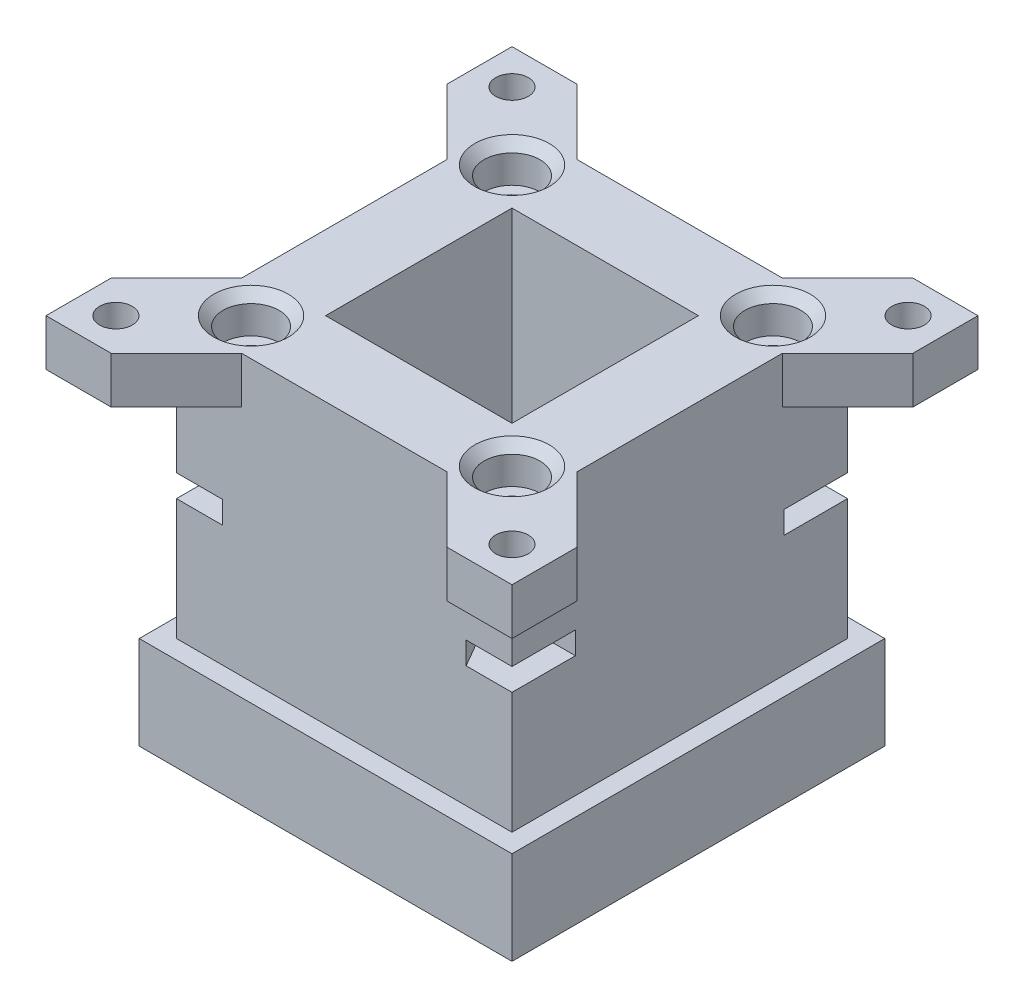
from build123d import *

# Parameters (mm, degrees)
SKETCH1_W           = 36
SKETCH1_H           = 36
SKETCH1_W_2         = 20
SKETCH1_H_2         = 20
BOSS_EXTRUDE4_DEPTH = 35
SKETCH9_W           = 50
SKETCH9_H           = 50
SKETCH9_W_2         = 22
SKETCH9_H_2         = 22
BOSS_EXTRUDE6_DEPTH = 5
SKETCH10_R          = 1.75
CUT_EXTRUDE2_DEPTH  = 10
CUT_EXTRUDE3_DEPTH  = 10
SKETCH4_W           = 40
SKETCH4_H           = 40
BOSS_EXTRUDE7_DEPTH = 10
SKETCH12_R          = 3
CUT_EXTRUDE4_DEPTH  = 4
CHAMFER1_SIZE       = 1
SKETCH13_R          = 1.75
CUT_EXTRUDE5_DEPTH  = 13
CUT_EXTRUDE7_DEPTH  = 2.4


with BuildPart() as part:
    # Sketch1 → Boss-Extrude4 (new body)
    with BuildSketch(Plane(origin=(0, 0, 0), x_dir=(1, 0, 0), z_dir=(0, 1, 0))):
        Rectangle(SKETCH1_W, SKETCH1_H)
        Rectangle(SKETCH1_W_2, SKETCH1_H_2, mode=Mode.SUBTRACT)
    extrude(amount=BOSS_EXTRUDE4_DEPTH)

    # Sketch9 → Boss-Extrude6 (add)
    with BuildSketch(Plane(origin=(0, 30, 0), x_dir=(1, 0, 0), z_dir=(0, 1, 0))):
        Rectangle(SKETCH9_W, SKETCH9_H)
        Rectangle(SKETCH9_W_2, SKETCH9_H_2, mode=Mode.SUBTRACT)
    extrude(amount=BOSS_EXTRUDE6_DEPTH)

    # Sketch10 → Cut-Extrude2 (cut)
    with BuildSketch(Plane(origin=(0, 25, 0), x_dir=(1, 0, 0), z_dir=(0, 1, 0))):
        with Locations((-21.25, 21.25)):
            Circle(SKETCH10_R)
        with Locations((21.25, 21.25)):
            Circle(SKETCH10_R)
        with Locations((21.25, -21.25)):
            Circle(SKETCH10_R)
        with Locations((-21.25, -21.25)):
            Circle(SKETCH10_R)
    extrude(amount=CUT_EXTRUDE2_DEPTH, mode=Mode.SUBTRACT)

    # Sketch11 → Cut-Extrude3 (cut)
    with BuildSketch(Plane(origin=(0, 25, 0), x_dir=(1, 0, 0), z_dir=(0, 1, 0))):
        Polygon((11, 18), (-11, 18), (-18, 25), (18, 25), align=None)
        Polygon((18, 11), (18, -11), (25, -18), (25, 18), align=None)
        Polygon((11, -18), (-11, -18), (-18, -25), (18, -25), align=None)
        Polygon((-18, 11), (-18, -11), (-25, -18), (-25, 18), align=None)
    extrude(amount=CUT_EXTRUDE3_DEPTH, mode=Mode.SUBTRACT)

    # Sketch4 → Boss-Extrude7 (add)
    with BuildSketch(Plane(origin=(0, -5, 0), x_dir=(1, 0, 0), z_dir=(0, 1, 0))):
        Rectangle(SKETCH4_W, SKETCH4_H)
        Polygon((-2.5, -8.548100716), (-2.5, -10), (-10, -10), (-10, -2.5), (-8.422351936, -2.5), (-4.844140472, -8.569430344), align=None, mode=Mode.SUBTRACT)
        Polygon((7.534421013, 0), (3.767210506, 6.525), (-3.767210506, 6.525), (-7.534421013, 0), (-3.767210506, -6.525), (3.767210506, -6.525), align=None, mode=Mode.SUBTRACT)
        Polygon((10, 10), (2.5, 10), (2.5, 8.548100716), (4.844140472, 8.569430344), (8.422351936, 2.5), (10, 2.5), align=None, mode=Mode.SUBTRACT)
        Polygon((10, -10), (2.5, -10), (2.5, -8.502605089), (4.999274138, -8.47986388), (8.379580585, -2.5), (10, -2.5), align=None, mode=Mode.SUBTRACT)
        Polygon((-10, 10), (-10, 2.5), (-8.379580585, 2.5), (-4.999274138, 8.47986388), (-2.5, 8.502605089), (-2.5, 10), align=None, mode=Mode.SUBTRACT)
    extrude(amount=BOSS_EXTRUDE7_DEPTH)

    # Sketch12 → Cut-Extrude4 (cut)
    with BuildSketch(Plane(origin=(0, 35, 0), x_dir=(1, 0, 0), z_dir=(0, 1, 0))):
        with Locations((-14, 14)):
            Circle(SKETCH12_R)
        with Locations((14, 14)):
            Circle(SKETCH12_R)
        with Locations((-14, -14)):
            Circle(SKETCH12_R)
        with Locations((14, -14)):
            Circle(SKETCH12_R)
    extrude(amount=-CUT_EXTRUDE4_DEPTH, mode=Mode.SUBTRACT)

    # Chamfer1
    chamfer1_edges = [part.edges().sort_by_distance(p)[0] for p in [
        (-17, 35, -14),
        (-17, 35, 14),
        (11, 35, 14),
        (11, 35, -14),
    ]]
    chamfer(chamfer1_edges, length=CHAMFER1_SIZE)

    # Sketch13 → Cut-Extrude5 (cut)
    with BuildSketch(Plane(origin=(0, 31, 0), x_dir=(1, 0, 0), z_dir=(0, 1, 0))):
        with Locations((-14, 14)):
            Circle(SKETCH13_R)
        with Locations((14, 14)):
            Circle(SKETCH13_R)
        with Locations((14, -14)):
            Circle(SKETCH13_R)
        with Locations((-14, -14)):
            Circle(SKETCH13_R)
    extrude(amount=-CUT_EXTRUDE5_DEPTH, mode=Mode.SUBTRACT)

    # Sketch15 → Cut-Extrude7 (cut)
    with BuildSketch(Plane(origin=(0, 18, 0), x_dir=(1, 0, 0), z_dir=(0, 1, 0))):
        Polygon((-10.766838493, 14), (-12.383419246, 16.8), (-15.581535205, 22.339299329), (-24.484943605, 19.967960566), (-22.149680093, 11.2), (-15.616580754, 11.2), (-12.383419246, 11.2), align=None)
        Polygon((15.616580754, 11.2), (12.383419246, 11.2), (10.766838493, 14), (12.383419246, 16.8), (15.581535205, 22.339299329), (24.484943605, 19.967960566), (22.149680093, 11.2), align=None)
        Polygon((15.616580754, -11.2), (12.383419246, -11.2), (10.766838493, -14), (12.383419246, -16.8), (15.581535205, -22.339299329), (24.484943605, -19.967960566), (22.149680093, -11.2), align=None)
        Polygon((-15.616580754, -11.2), (-12.383419246, -11.2), (-10.766838493, -14), (-12.383419246, -16.8), (-15.581535205, -22.339299329), (-24.484943605, -19.967960566), (-22.149680093, -11.2), align=None)
    extrude(amount=CUT_EXTRUDE7_DEPTH, mode=Mode.SUBTRACT)


solid = part.part
